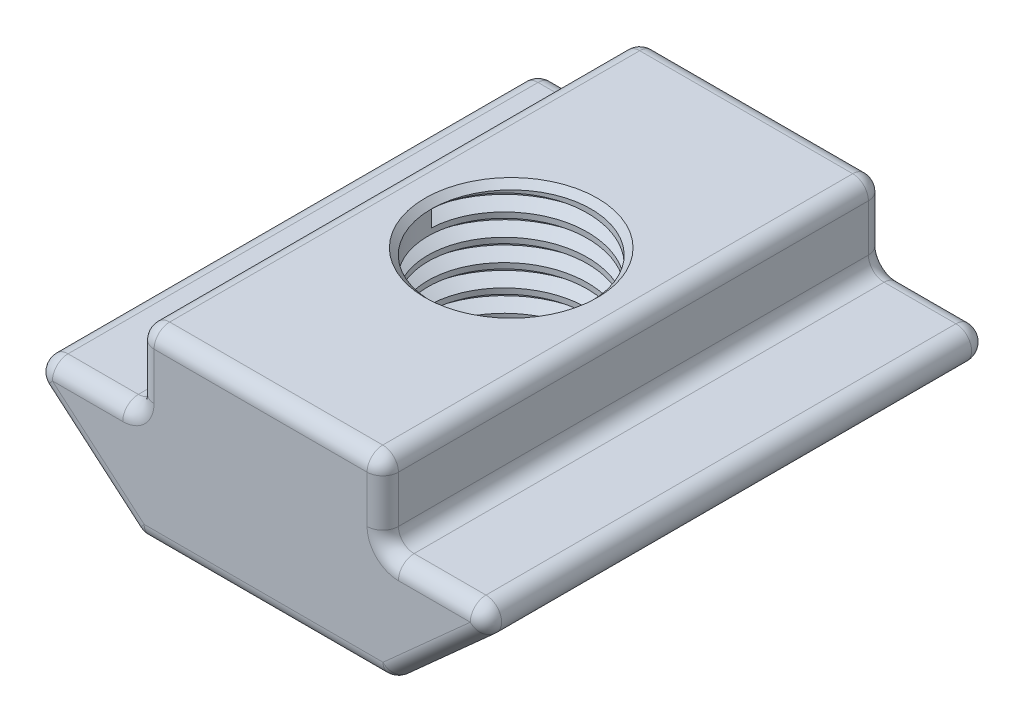
from build123d import *

# Parameters (mm, degrees)
Y_KSEKLIK_EKSTR_ZYON1_DEPTH = 8
IZIM2_R                     = 2.55
KES_EKSTR_ZYON3_DEPTH       = 16.543809057
PAH2_SIZE                   = 0.2
DI_1_PITCH                  = 0.7
RADYUS1_R                   = 0.5


with BuildPart() as part:
    # Çizim1 → Yükseklik-Ekstrüzyon1 (new, symmetric)
    with BuildSketch(Plane.XY):
        Polygon((0, 0), (-7.8, 0), (-7.8, -2.5), (-11.9, -2.5), (-7.8, -6), (0.2, -6), (4.1, -2.5), (0, -2.5), align=None)
    extrude(amount=Y_KSEKLIK_EKSTR_ZYON1_DEPTH, both=True)

    # Çizim2 → Kes-Ekstrüzyon3 (cut, through all)
    with BuildSketch(Plane(origin=(0, 0, 0), x_dir=(1, 0, 0), z_dir=(0, 1, 0))):
        with Locations(Location((-3.9, 0, 0), (0, 0, 180))):
            Circle(IZIM2_R)
    extrude(amount=-KES_EKSTR_ZYON3_DEPTH, mode=Mode.SUBTRACT)

    # Pah2
    pah2_edges = [part.edges().sort_by_distance(p)[0] for p in [
        (-1.35, 0, 0),
    ]]
    chamfer(pah2_edges, length=PAH2_SIZE)

    # Diş1: the profile of Diş Profili1 profile screwed along a right-hand helix of 8.571429 turns, 6 arcs to a turn; built about Z, then put on its axis
    di_1_z = Axis((0, 0, 0), (0, 0, 1))
    di_1_corners = [(2.5497, 0, -0.000173205), (2.928886112, 0, 0.218749999), (2.928886112, 0, 0.306249999), (2.5497, 0, 0.525173203)]
    with BuildLine(mode=Mode.PRIVATE) as di_1_profile:
        Line(di_1_corners[0], di_1_corners[1])
        Line(di_1_corners[1], di_1_corners[2])
        Line(di_1_corners[2], di_1_corners[3])
        Line(di_1_corners[3], di_1_corners[0])
    di_1_cap = Face(di_1_profile.wire())
    di_1_turn_angles = [0, 30, 60, 90, 120, 150, 180, 210, 240, 270, 300, 330, 360]
    di_1_turn_weights = [1, 0.8660254037844387, 1, 0.8660254037844387, 1, 0.8660254037844387, 1, 0.8660254037844387, 1, 0.8660254037844387, 1, 0.8660254037844387, 1]
    di_1_turn_rails = [Edge.make_bspline([Vector(p[0], p[1], 0).rotate(di_1_z, di_1_turn_angles[k]) / di_1_turn_weights[k] + Vector(0, 0, p[2] + DI_1_PITCH * di_1_turn_angles[k] / 360) for k in range(13)], [0, 0, 0, 1, 1, 2, 2, 3, 3, 4, 4, 5, 5, 6, 6, 6], 2, di_1_turn_weights) for p in di_1_corners]
    di_1_turn_sides = [Face.make_surface_from_curves(di_1_turn_rails[p[0]], di_1_turn_rails[p[1]]) for p in [(0, 1), (1, 2), (2, 3), (3, 0)]]
    di_1_last_angles = [2880, 2910, 2940, 2970, 3000, 3030, 3060, 3072.857142857, 3085.714285714]
    di_1_last_weights = [1, 0.8660254037844387, 1, 0.8660254037844387, 1, 0.8660254037844387, 1, 0.9749279121818235, 1]
    di_1_last_rails = [Edge.make_bspline([Vector(p[0], p[1], 0).rotate(di_1_z, di_1_last_angles[k]) / di_1_last_weights[k] + Vector(0, 0, p[2] + DI_1_PITCH * di_1_last_angles[k] / 360) for k in range(9)], [0, 0, 0, 1, 1, 2, 2, 3, 3, 4, 4, 4], 2, di_1_last_weights) for p in di_1_corners]
    di_1_last_sides = [Face.make_surface_from_curves(di_1_last_rails[p[0]], di_1_last_rails[p[1]]) for p in [(0, 1), (1, 2), (2, 3), (3, 0)]]
    di_1 = Plane(origin=(-3.9, -0.2, 0), x_dir=(-1, 0, 0), z_dir=(0, -1, 0)) * Solid(Shell([*[p.moved(Location((0, 0, DI_1_PITCH * i))) for i in range(8) for p in di_1_turn_sides], *di_1_last_sides, di_1_cap, di_1_cap.rotate(di_1_z, 3085.714285714).moved(Location((0, 0, DI_1_PITCH * 3085.714285714 / 360)))]))
    add(di_1, mode=Mode.SUBTRACT)

    # Radyus1
    radyus1_edges = [part.edges().sort_by_distance(p)[0] for p in [
        (-9.85, -2.5, -8),
        (-7.8, -1.25, -8),
        (-3.9, 0, -8),
        (0, -1.25, -8),
        (-7.8, -1.25, 8),
        (0, -2.5, 0),
        (4.1, -2.5, 0),
        (0.2, -6, 0),
        (-7.8, -6, 0),
        (-11.9, -2.5, 0),
        (-7.8, -2.5, 0),
        (-7.8, 0, 0),
        (0, 0, 0),
        (-9.85, -2.5, 8),
        (-9.85, -4.25, 8),
        (-3.8, -6, 8),
        (2.15, -4.25, 8),
        (2.05, -2.5, 8),
        (0, -1.25, 8),
        (2.05, -2.5, -8),
        (-3.9, 0, 8),
        (2.15, -4.25, -8),
        (-3.8, -6, -8),
        (-9.85, -4.25, -8),
    ]]
    fillet(radyus1_edges, radius=RADYUS1_R)


solid = part.part
